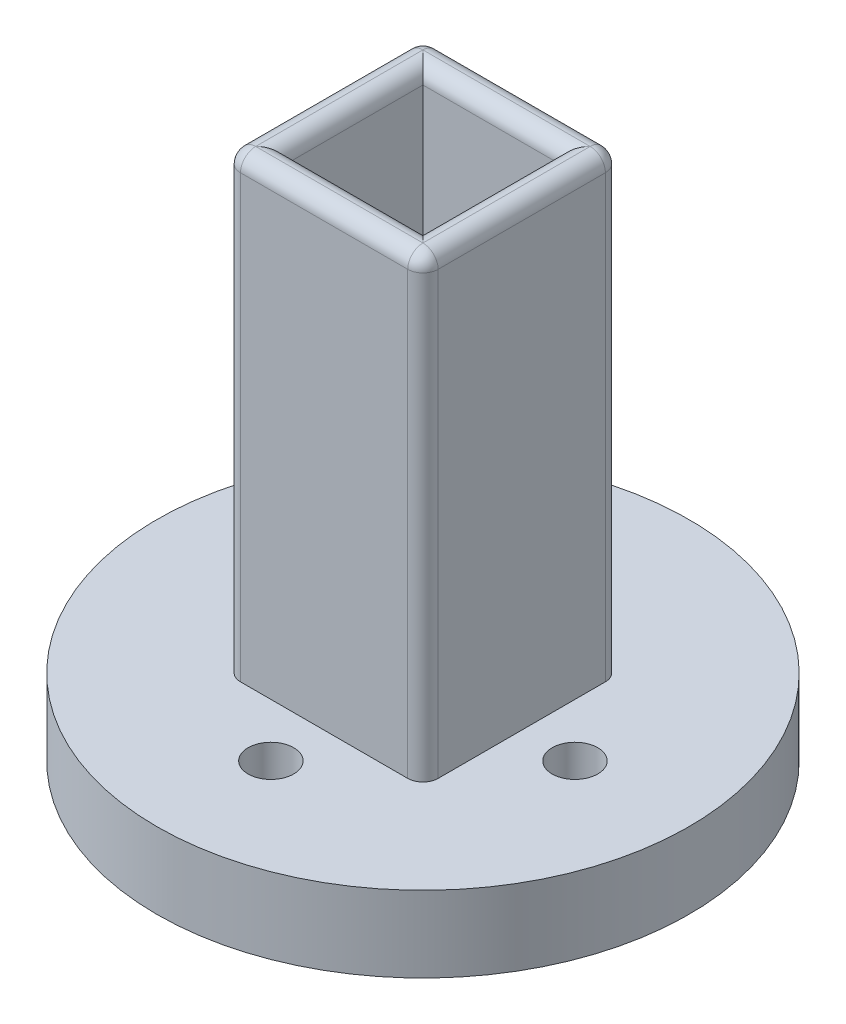
from build123d import *

# Parameters (mm, degrees)
SKETCH_1_R      = 17.5
SKETCH_1_R_2    = 4.05
SKETCH_1_R_3    = 1.5
EXTRUDE_1_DEPTH = 5
SKETCH_2_W      = 13
SKETCH_2_H      = 13
SKETCH_2_W_2    = 9
SKETCH_2_H_2    = 9
EXTRUDE_2_DEPTH = 30
FILLET_1_R      = 1


with BuildPart() as part:
    # 草图1 → 凸台-拉伸1 (new body)
    with BuildSketch(Plane(origin=(0, 0, 0), x_dir=(1, 0, 0), z_dir=(0, 1, 0))):
        with Locations(Location((0, 0, 0), (0, 0, 270))):
            Circle(SKETCH_1_R)
        with Locations(Location((0, 0, 0), (0, 0, 270))):
            Circle(SKETCH_1_R_2, mode=Mode.SUBTRACT)
        with Locations(Location((0, 10, 0), (0, 0, 270))):
            Circle(SKETCH_1_R_3, mode=Mode.SUBTRACT)
        with Locations(Location((10, 0, 0), (0, 0, 270))):
            Circle(SKETCH_1_R_3, mode=Mode.SUBTRACT)
        with Locations(Location((0, -10, 0), (0, 0, 270))):
            Circle(SKETCH_1_R_3, mode=Mode.SUBTRACT)
        with Locations(Location((-10, 0, 0), (0, 0, 270))):
            Circle(SKETCH_1_R_3, mode=Mode.SUBTRACT)
    extrude(amount=EXTRUDE_1_DEPTH)

    # 草图2 → 凸台-拉伸2 (add)
    with BuildSketch(Plane(origin=(0, 5, 0), x_dir=(1, 0, 0), z_dir=(0, 1, 0))):
        Rectangle(SKETCH_2_W, SKETCH_2_H)
        Rectangle(SKETCH_2_W_2, SKETCH_2_H_2, mode=Mode.SUBTRACT)
    extrude(amount=EXTRUDE_2_DEPTH)

    # 圆角1
    fillet_1_edges = [part.edges().sort_by_distance(p)[0] for p in [
        (0, 35, -6.5),
        (-6.5, 35, 0),
        (0, 35, 6.5),
        (6.5, 35, 0),
        (6.5, 20, -6.5),
        (-6.5, 20, -6.5),
        (-6.5, 20, 6.5),
        (6.5, 20, 6.5),
        (-4.5, 35, 0),
        (0, 35, 4.5),
        (4.5, 35, 0),
        (0, 35, -4.5),
    ]]
    fillet(fillet_1_edges, radius=FILLET_1_R - 0.0001)  # a hair under: the kernel refuses the full size


solid = part.part
